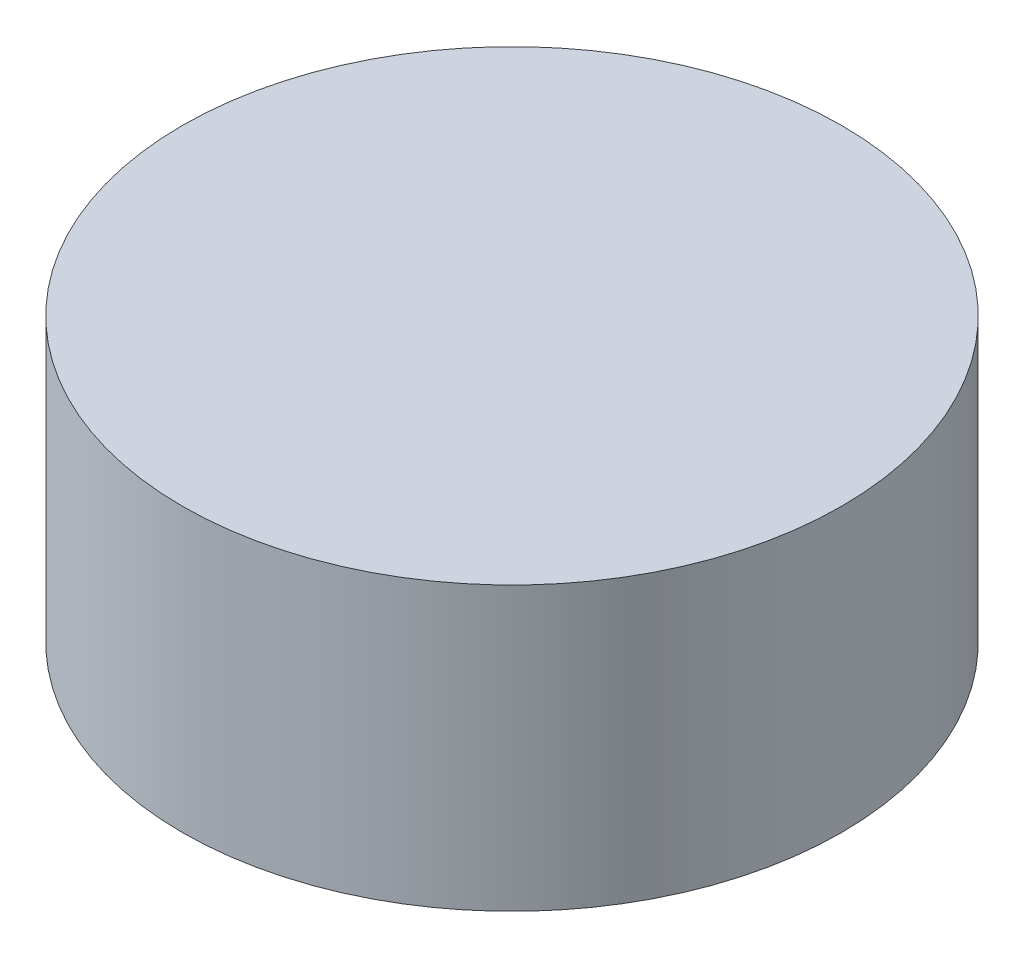
from build123d import *

# Parameters (mm, degrees)
SKETCH_1_W = 3.5
SKETCH_1_H = 3


with BuildPart() as part:
    # 草图1 → Revolve 2 (revolve)
    with BuildSketch(Plane.XY):
        with Locations((1.75, 1.5)):
            Rectangle(SKETCH_1_W, SKETCH_1_H)
    revolve(axis=Axis((0, 0, 0), (0, 1, 0)))


solid = part.part
